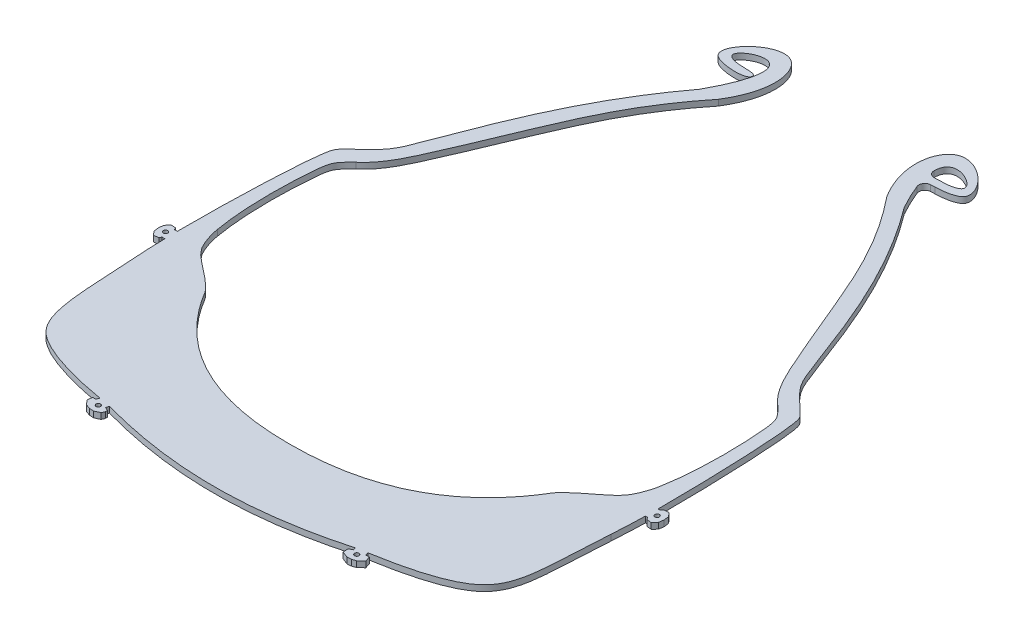
from build123d import *

# Parameters (mm, degrees)
SKETCH2_R           = 0.75
BOSS_EXTRUDE2_DEPTH = 2


with BuildPart() as part:
    # Sketch2 → Boss-Extrude2 (new body)
    with BuildSketch(Plane(origin=(0, 0, 0), x_dir=(1, 0, 0), z_dir=(0, 1, 0))):
        with BuildLine():
            Line((-18.534662591, 4633.795971308), (-16.94232243, 4635.297018365))
            Line((-16.94232243, 4635.297018365), (-17.480735808, 4637.014274136))
            Line((-17.480735808, 4637.014274136), (-18.723139757, 4637.014274136))
            Line((-18.723139757, 4637.014274136), (-18.943384636, 4638.035656948))
            add(Edge.make_bspline(
                [(-18.943384636, 4638.035656948), (-9.024791136, 4639.685871765), (4.646728482, 4643.060373116), (16.372015333, 4654.394416396), (15.252352932, 4666.334603474), (16.61721801, 4684.514714632)],
                knots=[0.018902136, 0.018902136, 0.018902136, 0.018902136, 0.394121885, 0.490994555, 0.987628845, 0.987628845, 0.987628845, 0.987628845], degree=3))
            add(Edge.make_bspline(
                [(16.61721801, 4684.514714632), (16.759333405, 4687.588466409), (17.055168032, 4691.324791696), (17.092983379, 4695.519138342)],
                knots=[0.004734857, 0.004734857, 0.004734857, 0.004734857, 0.035161677, 0.035161677, 0.035161677, 0.035161677], degree=3))
            Line((17.092983379, 4695.519138342), (17.926998071, 4695.519138342))
            Line((17.926998071, 4695.519138342), (18.350912407, 4694.80522007))
            Line((18.350912407, 4694.80522007), (19.990327064, 4694.624725063))
            Line((19.990327064, 4694.624725063), (21.136229719, 4695.944509376))
            Line((21.136229719, 4695.944509376), (21.376030634, 4697.597182293))
            Line((21.376030634, 4697.597182293), (21.181227948, 4699.255761252))
            Line((21.181227948, 4699.255761252), (20.071612224, 4700.606196913))
            Line((20.071612224, 4700.606196913), (18.427898205, 4700.470317954))
            Line((18.427898205, 4700.470317954), (17.927254585, 4699.790846236))
            Line((17.927254585, 4699.790846236), (17.151033717, 4699.790846236))
            add(Edge.make_bspline(
                [(17.151033717, 4699.790846236), (17.186998591, 4718.753185432), (15.94634825, 4748.148860321), (12.996151343, 4752.209564814), (5.590245105, 4758.14453206), (-2.080870076, 4776.039451645), (-10.769903785, 4804.544180166), (-29.384065315, 4829.308158932)],
                knots=[0.044450265, 0.044450265, 0.044450265, 0.044450265, 0.175222915, 0.204984692, 0.326836548, 0.407861227, 1, 1, 1, 1], degree=3))
            add(Edge.make_bspline(
                [(-29.384065315, 4829.308158932), (-30.279828858, 4830.927940426), (-31.82897842, 4833.940600293), (-32.935620515, 4836.519574937), (-33.388876589, 4837.705671207)],
                knots=[0, 0, 0, 0, 0.008448935, 0.016897871, 0.016897871, 0.016897871, 0.016897871], degree=3))
            ThreePointArc((-33.388876589, 4837.705671207), (-33.195017151, 4839.513430798), (-31.617463131, 4840.417255745))
            Line((-31.617463131, 4840.417255745), (-30.132913004, 4840.48920884))
            add(Edge.make_bspline(
                [(-30.132913004, 4840.48920884), (-27.348136015, 4840.486799518), (-22.586268343, 4841.44791901), (-20.649318917, 4847.696809089), (-38.099603445, 4862.694970909), (-42.592095957, 4840.959775456), (-35.552292937, 4829.654236917)],
                knots=[0.329045507, 0.329045507, 0.329045507, 0.329045507, 0.418095269, 0.461523944, 0.763332252, 1, 1, 1, 1], degree=3))
            add(Edge.make_bspline(
                [(7.185980508, 4750.111001922), (2.64601717, 4753.915516125), (-14.478030794, 4791.023782379), (-18.864087923, 4808.826517659), (-35.552292937, 4829.654236917)],
                knots=[0, 0, 0, 0, 0.147117654, 0.925748444, 0.925748444, 0.925748444, 0.925748444], degree=3))
            add(Edge.make_bspline(
                [(10.929843589, 4707.061813065), (12.525657705, 4715.665959829), (12.951032272, 4730.905308146), (11.209063847, 4746.24867545), (8.683440025, 4748.70910668), (7.185980508, 4750.111001922)],
                knots=[0, 0, 0, 0, 0.797699661, 0.897699661, 1, 1, 1, 1], degree=3))
            add(Edge.make_bspline(
                [(-5.29304341, 4686.669702846), (-3.38818728, 4689.514746254), (5.532154051, 4695.631638467), (7.015760007, 4697.627016687), (8.918521131, 4699.957235784), (10.648905964, 4704.644766972), (10.929843589, 4707.061813065)],
                knots=[0, 0, 0, 0, 0.517384858, 0.711983816, 0.762677817, 1, 1, 1, 1], degree=3))
            add(Edge.make_bspline(
                [(-63.92338013, 4656.572608608), (-23.322121525, 4656.452117341), (-5.29304341, 4686.669702846)],
                knots=[0, 0, 0, 1, 1, 1], degree=2))
            add(Edge.make_bspline(
                [(-63.92338013, 4656.572608608), (-104.524638736, 4656.452117341), (-122.553716851, 4686.669702846)],
                knots=[0, 0, 0, 1, 1, 1], degree=2))
            add(Edge.make_bspline(
                [(-122.553716851, 4686.669702846), (-124.458572981, 4689.514746254), (-133.378914312, 4695.631638467), (-134.862520268, 4697.627016687), (-136.765281392, 4699.957235784), (-138.495666225, 4704.644766972), (-138.776603849, 4707.061813065)],
                knots=[0, 0, 0, 0, 0.517384858, 0.711983816, 0.762677817, 1, 1, 1, 1], degree=3))
            add(Edge.make_bspline(
                [(-138.776603849, 4707.061813065), (-140.372417965, 4715.665959829), (-140.797792532, 4730.905308146), (-139.055824108, 4746.24867545), (-136.530200286, 4748.70910668), (-135.032740768, 4750.111001922)],
                knots=[0, 0, 0, 0, 0.797699661, 0.897699661, 1, 1, 1, 1], degree=3))
            add(Edge.make_bspline(
                [(-135.032740768, 4750.111001922), (-130.492777431, 4753.915516125), (-113.368729467, 4791.023782379), (-108.982672337, 4808.826517659), (-92.294467324, 4829.654236917)],
                knots=[0, 0, 0, 0, 0.147117654, 0.925748444, 0.925748444, 0.925748444, 0.925748444], degree=3))
            add(Edge.make_bspline(
                [(-98.462694945, 4829.308158932), (-93.338195312, 4838.574633039), (-89.913156134, 4854.996465173), (-105.756856512, 4846.135739219), (-99.848292849, 4842.664556703), (-93.610122483, 4843.659883255), (-92.605535221, 4839.788119538), (-104.615534605, 4840.368637544), (-107.728039879, 4847.462077891), (-89.655447145, 4862.697351888), (-85.254664303, 4840.959775456), (-92.294467324, 4829.654236917)],
                knots=[0, 0, 0, 0, 0.048334816, 0.142928243, 0.162159562, 0.231927069, 0.259382175, 0.409255519, 0.461523944, 0.763332252, 1, 1, 1, 1], degree=3))
            add(Edge.make_bspline(
                [(-144.997793977, 4699.790846236), (-145.140739705, 4717.900779), (-143.980499513, 4747.781602798), (-140.945925182, 4752.343329702), (-133.518546426, 4758.095548291), (-125.834467772, 4776.247277702), (-117.076856476, 4804.544180166), (-98.462694945, 4829.308158932)],
                knots=[0.034255764, 0.034255764, 0.034255764, 0.034255764, 0.174203465, 0.204984692, 0.326836548, 0.407861227, 1, 1, 1, 1], degree=3))
            Line((-144.997793977, 4699.790846236), (-146.077436972, 4699.790846236))
            Line((-146.077436972, 4699.790846236), (-146.274658466, 4700.470317954))
            Line((-146.274658466, 4700.470317954), (-147.918372484, 4700.606196913))
            Line((-147.918372484, 4700.606196913), (-149.027988208, 4699.255761252))
            Line((-149.027988208, 4699.255761252), (-149.222790895, 4697.597182293))
            Line((-149.222790895, 4697.597182293), (-148.98298998, 4695.944509376))
            Line((-148.98298998, 4695.944509376), (-147.918372484, 4694.624725063))
            Line((-147.918372484, 4694.624725063), (-146.197672667, 4694.80522007))
            Line((-146.197672667, 4694.80522007), (-145.939352996, 4695.519138342))
            Line((-145.939352996, 4695.519138342), (-144.93974364, 4695.519138342))
            add(Edge.make_bspline(
                [(-144.749408582, 4689.48069966), (-144.833889745, 4691.307900212), (-144.896771823, 4693.342403801), (-144.93974364, 4695.519138342)],
                knots=[0.004734856, 0.004734856, 0.004734856, 0.004734856, 0.022822175, 0.022822175, 0.022822175, 0.022822175], degree=3))
            add(Edge.make_bspline(
                [(-109.337236897, 4638.021190769), (-119.14352525, 4639.685319313), (-132.602811475, 4643.251798031), (-144.259959312, 4654.289514228), (-143.359552227, 4671.437825607), (-144.749408582, 4689.48069966)],
                knots=[0.024855616, 0.024855616, 0.024855616, 0.024855616, 0.394717233, 0.49149328, 0.992616091, 0.992616091, 0.992616091, 0.992616091], degree=3))
            Line((-109.337236897, 4638.021190769), (-109.700510236, 4637.019084317))
            Line((-109.700510236, 4637.019084317), (-110.673720292, 4637.019084317))
            Line((-110.673720292, 4637.019084317), (-110.924641203, 4636.340202994))
            Line((-110.924641203, 4636.340202994), (-110.946606143, 4635.298940402))
            Line((-110.946606143, 4635.298940402), (-109.697513062, 4633.834340317))
            Line((-109.697513062, 4633.834340317), (-108.20431104, 4633.292684057))
            Line((-108.20431104, 4633.292684057), (-106.620311483, 4633.174408169))
            Line((-106.620311483, 4633.174408169), (-104.880493791, 4633.998010823))
            Line((-104.880493791, 4633.998010823), (-104.473549573, 4634.956711321))
            Line((-104.473549573, 4634.956711321), (-104.473549573, 4635.740406818))
            Line((-104.473549573, 4635.740406818), (-105.629701484, 4636.159523134))
            Line((-105.629701484, 4636.159523134), (-105.348248264, 4637.239361207))
            add(Edge.make_bspline(
                [(-105.348248264, 4637.239361207), (-91.773973611, 4633.449581192), (-63.91646452, 4629.348089946), (-36.074978393, 4633.559092847), (-22.498511996, 4637.355076027)],
                knots=[0.018742307, 0.018742307, 0.018742307, 0.018742307, 0.500293183, 0.981944699, 0.981944699, 0.981944699, 0.981944699], degree=3))
            Line((-22.498511996, 4637.355076027), (-22.26922003, 4636.472511323))
            Line((-22.26922003, 4636.472511323), (-23.480509856, 4635.86569876))
            Line((-23.480509856, 4635.86569876), (-23.346608072, 4634.07100473))
            Line((-23.346608072, 4634.07100473), (-21.312460887, 4633.264199495))
            Line((-21.312460887, 4633.264199495), (-19.887255597, 4633.340434244))
            Line((-19.887255597, 4633.340434244), (-18.534662591, 4633.795971308))
        make_face()
        with Locations((-107.515119617, 4635.661753265)):
            Circle(SKETCH2_R, mode=Mode.SUBTRACT)
        with Locations((-146.82022248, 4697.629831976)):
            Circle(SKETCH2_R, mode=Mode.SUBTRACT)
        with Locations((-20.331640643, 4635.661753265)):
            Circle(SKETCH2_R, mode=Mode.SUBTRACT)
        with Locations((18.97346222, 4697.629831976)):
            Circle(SKETCH2_R, mode=Mode.SUBTRACT)
        with BuildLine():
            add(Edge.make_bspline(
                [(-35.080655121, 4845.088103544), (-35.074842795, 4845.793132549), (-34.080126449, 4852.840999723), (-22.333127952, 4846.309336145), (-27.086396332, 4843.068813631), (-30.503691524, 4843.207264923), (-32.298353483, 4843.110786916)],
                knots=[0.039445136, 0.039445136, 0.039445136, 0.039445136, 0.048334816, 0.142928243, 0.159172541, 0.210777803, 0.210777803, 0.210777803, 0.210777803], degree=3))
            Line((-32.298353483, 4843.110786916), (-32.973361471, 4843.074499622))
            ThreePointArc((-32.973361471, 4843.074499622), (-34.462427064, 4843.625623485), (-35.080655121, 4845.088103544))
        make_face(mode=Mode.SUBTRACT)
    extrude(amount=BOSS_EXTRUDE2_DEPTH)


solid = part.part
